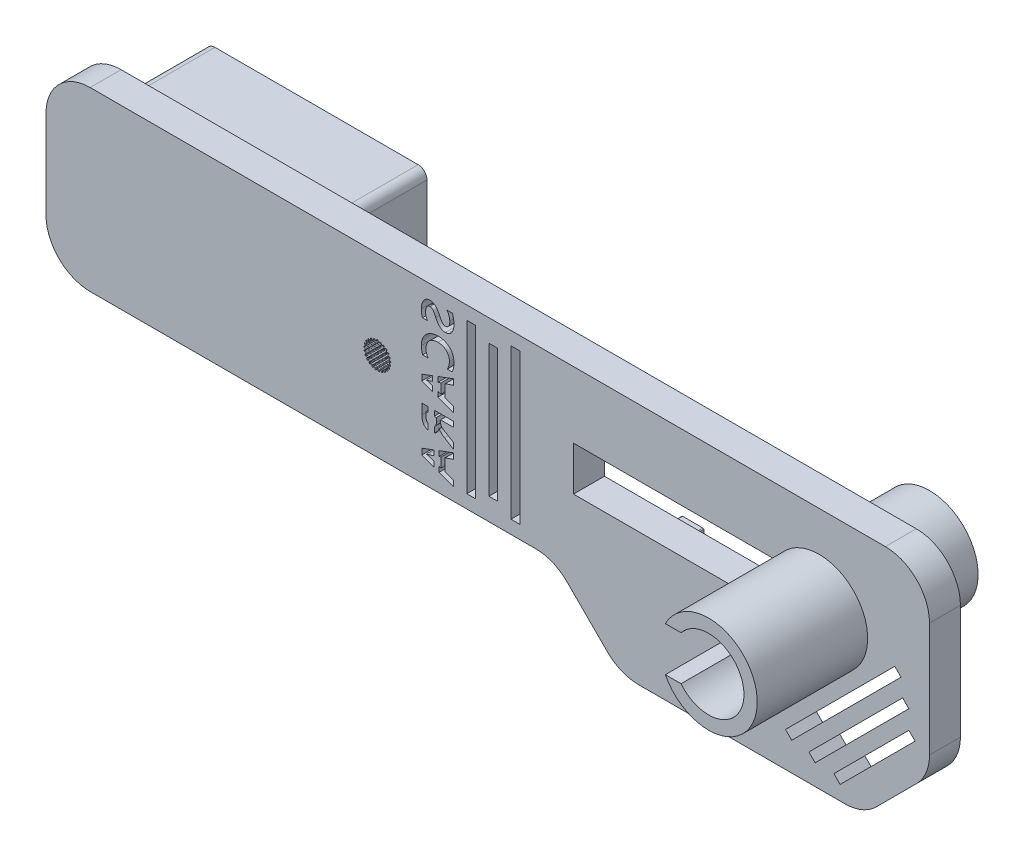
from build123d import *

# Parameters (mm, degrees)
CROQUIS1_W               = 200
CROQUIS1_H               = 40
SALIENTE_EXTRUIR1_DEPTH  = 7
CORTAR_EXTRUIR1_DEPTH    = 10
SALIENTE_EXTRUIR3_DEPTH  = 25
SALIENTE_EXTRUIR5_DEPTH  = 7
CROQUIS9_W               = 5
CROQUIS9_H               = 8
SALIENTE_EXTRUIR6_DEPTH  = 12
CROQUIS10_R              = 1
CORTAR_EXTRUIR2_DEPTH    = 4
CROQUIS11_W              = 50
CROQUIS11_H              = 30
SALIENTE_EXTRUIR7_DEPTH  = 20
CROQUIS12_R              = 1.5
CORTAR_EXTRUIR3_DEPTH    = 10
REDONDEO1_R              = 2
REDONDEO2_R              = 10
REDONDEO3_R              = 0.2
CORTAR_EXTRUIR6_DEPTH    = 7
CROQUIS15_W              = 1.2
CROQUIS15_H              = 5
CROQUIS15_W_2            = 1.4
CROQUIS15_H_2            = 6
SALIENTE_EXTRUIR9_DEPTH  = 7
CROQUIS16_W              = 2
CROQUIS16_H              = 34
CROQUIS16_H_2            = 30
CORTAR_EXTRUIR7_DEPTH    = 7
CORTAR_EXTRUIR8_DEPTH    = 7
CROQUIS19_R              = 3.5
CROQUIS19_R_2            = 1.1
SALIENTE_EXTRUIR10_DEPTH = 3
CROQUIS20_R              = 2.75
CORTAR_EXTRUIR9_DEPTH    = 2.3


with BuildPart() as part:
    # Croquis1 → Saliente-Extruir1 (new body)
    with BuildSketch(Plane.XY):
        with Locations((35.75, 0)):
            Rectangle(CROQUIS1_W, CROQUIS1_H)
        with BuildLine():
            Line((12.626451574, 2.246768253), (12.528569084, 2.182348387))
            ThreePointArc((12.528569084, 2.182348387), (12.34583696, 2.19648114), (12.275928582, 2.365902456))
            Line((12.275928582, 2.365902456), (12.306948162, 2.47890107))
            add(Edge.make_bspline(
                [(12.306948162, 2.47890107), (12.313956369, 2.504430674), (12.318320471, 2.530953923), (12.317315161, 2.571661589), (12.315717027, 2.585623842), (12.30707454, 2.61274149), (12.299647057, 2.627040418), (12.286059536, 2.634961309)],
                knots=[0, 0, 0, 0, 0.5, 0.5, 0.75, 0.75, 1, 1, 1, 1], degree=3))
            ThreePointArc((12.286059536, 2.634961309), (12.219348706, 2.672735374), (12.151709558, 2.708820835))
            add(Edge.make_bspline(
                [(12.151709558, 2.708820835), (12.13775279, 2.71604292), (12.121806118, 2.714681589), (12.094149563, 2.707429812), (12.081587369, 2.701329447), (12.046673806, 2.680382622), (12.026552357, 2.662434562), (12.008750854, 2.642836427)],
                knots=[0, 0, 0, 0, 0.25, 0.25, 0.5, 0.5, 1, 1, 1, 1], degree=3))
            Line((12.008750854, 2.642836427), (11.929964091, 2.556098044))
            ThreePointArc((11.929964091, 2.556098044), (11.749458161, 2.524343159), (11.639612715, 2.671056287))
            Line((11.639612715, 2.671056287), (11.641556145, 2.788219097))
            add(Edge.make_bspline(
                [(11.641556145, 2.788219097), (11.641995222, 2.814689512), (11.639626154, 2.841464792), (11.628528843, 2.880643542), (11.623508646, 2.893769705), (11.608393794, 2.917886104), (11.59764366, 2.929888665), (11.58251317, 2.934181627)],
                knots=[0, 0, 0, 0, 0.5, 0.5, 0.75, 0.75, 1, 1, 1, 1], degree=3))
            ThreePointArc((11.58251317, 2.934181627), (11.508504156, 2.954178641), (11.434015927, 2.972309239))
            add(Edge.make_bspline(
                [(11.434015927, 2.972309239), (11.418701577, 2.975833522), (11.403594448, 2.970549183), (11.378610218, 2.956647329), (11.367959787, 2.947614528), (11.339352362, 2.918643136), (11.324326566, 2.896254945), (11.311958188, 2.872845469)],
                knots=[0, 0, 0, 0, 0.25, 0.25, 0.5, 0.5, 1, 1, 1, 1], degree=3))
            Line((11.311958188, 2.872845469), (11.257217615, 2.769238661))
            ThreePointArc((11.257217615, 2.769238661), (11.090279729, 2.693591414), (10.947399209, 2.808377827))
            Line((10.947399209, 2.808377827), (10.920144377, 2.922343064))
            add(Edge.make_bspline(
                [(10.920144377, 2.922343064), (10.913986734, 2.948091056), (10.905033354, 2.973435979), (10.884541326, 3.008624067), (10.876414505, 3.020089375), (10.855777008, 3.039689202), (10.842379694, 3.048641231), (10.826656941, 3.049036522)],
                knots=[0, 0, 0, 0, 0.5, 0.5, 0.75, 0.75, 1, 1, 1, 1], degree=3))
            ThreePointArc((10.826656941, 3.049036522), (10.75, 3.05), (10.673343059, 3.049036522))
            add(Edge.make_bspline(
                [(10.673343059, 3.049036522), (10.657633385, 3.048641559), (10.644315035, 3.039766248), (10.623572982, 3.020087821), (10.61550352, 3.008690147), (10.594999742, 2.973514567), (10.586013725, 2.948092979), (10.579855623, 2.922343064)],
                knots=[0, 0, 0, 0, 0.25, 0.25, 0.5, 0.5, 1, 1, 1, 1], degree=3))
            Line((10.579855623, 2.922343064), (10.552600791, 2.808377827))
            ThreePointArc((10.552600791, 2.808377827), (10.409720271, 2.693591414), (10.242782385, 2.769238661))
            Line((10.242782385, 2.769238661), (10.188041812, 2.872845469))
            add(Edge.make_bspline(
                [(10.188041812, 2.872845469), (10.175674357, 2.896253197), (10.160699238, 2.918575247), (10.132100083, 2.947561677), (10.121377275, 2.956645723), (10.096513865, 2.970497448), (10.081311173, 2.975836456), (10.065984073, 2.972309239)],
                knots=[0, 0, 0, 0, 0.5, 0.5, 0.75, 0.75, 1, 1, 1, 1], degree=3))
            ThreePointArc((10.065984073, 2.972309239), (9.991495844, 2.954178641), (9.91748683, 2.934181627))
            add(Edge.make_bspline(
                [(9.91748683, 2.934181627), (9.902368927, 2.929892236), (9.891676198, 2.917983619), (9.876479619, 2.893765087), (9.871498161, 2.880718699), (9.860386358, 2.841549142), (9.858004745, 2.814691489), (9.858443855, 2.788219097)],
                knots=[0, 0, 0, 0, 0.25, 0.25, 0.5, 0.5, 1, 1, 1, 1], degree=3))
            Line((9.858443855, 2.788219097), (9.860387285, 2.671056287))
            ThreePointArc((9.860387285, 2.671056287), (9.750541839, 2.524343159), (9.570035909, 2.556098044))
            Line((9.570035909, 2.556098044), (9.491249146, 2.642836427))
            add(Edge.make_bspline(
                [(9.491249146, 2.642836427), (9.473448973, 2.662433098), (9.453393056, 2.680329699), (9.418483765, 2.701293146), (9.405838722, 2.707425146), (9.378311658, 2.714658415), (9.362258829, 2.716048933), (9.348290442, 2.708820835)],
                knots=[0, 0, 0, 0, 0.5, 0.5, 0.75, 0.75, 1, 1, 1, 1], degree=3))
            ThreePointArc((9.348290442, 2.708820835), (9.280651294, 2.672735374), (9.213940464, 2.634961309))
            add(Edge.make_bspline(
                [(9.213940464, 2.634961309), (9.200364246, 2.627047007), (9.192969001, 2.612853348), (9.184272755, 2.585616451), (9.182692303, 2.571741101), (9.181670671, 2.531038735), (9.186043108, 2.504432581), (9.193051838, 2.47890107)],
                knots=[0, 0, 0, 0, 0.25, 0.25, 0.5, 0.5, 1, 1, 1, 1], degree=3))
            Line((9.193051838, 2.47890107), (9.224071418, 2.365902456))
            ThreePointArc((9.224071418, 2.365902456), (9.15416304, 2.19648114), (8.971430916, 2.182348387))
            Line((8.971430916, 2.182348387), (8.873548426, 2.246768253))
            add(Edge.make_bspline(
                [(8.873548426, 2.246768253), (8.851433984, 2.261322535), (8.827557457, 2.273669178), (8.788531508, 2.285292432), (8.774758767, 2.28808709), (8.746297675, 2.28824741), (8.730403367, 2.285602066), (8.718671378, 2.275127255)],
                knots=[0, 0, 0, 0, 0.5, 0.5, 0.75, 0.75, 1, 1, 1, 1], degree=3))
            ThreePointArc((8.718671378, 2.275127255), (8.662131327, 2.223354314), (8.606910368, 2.170176682))
            add(Edge.make_bspline(
                [(8.606910368, 2.170176682), (8.595728879, 2.159134754), (8.592095789, 2.143547892), (8.590446293, 2.115004024), (8.592366153, 2.101171551), (8.601498883, 2.061493855), (8.612350633, 2.036810963), (8.6254886, 2.013824572)],
                knots=[0, 0, 0, 0, 0.25, 0.25, 0.5, 0.5, 1, 1, 1, 1], degree=3))
            Line((8.6254886, 2.013824572), (8.683635255, 1.912090273))
            ThreePointArc((8.683635255, 1.912090273), (8.658056546, 1.730606132), (8.484579961, 1.671473755))
            Line((8.484579961, 1.671473755), (8.373752059, 1.709527367))
            add(Edge.make_bspline(
                [(8.373752059, 1.709527367), (8.34871288, 1.718124761), (8.322515994, 1.72414566), (8.28182553, 1.72569839), (8.267790482, 1.724980107), (8.240183677, 1.718057405), (8.22544659, 1.711542415), (8.216688161, 1.698479063)],
                knots=[0, 0, 0, 0, 0.5, 0.5, 0.75, 0.75, 1, 1, 1, 1], degree=3))
            ThreePointArc((8.216688161, 1.698479063), (8.174799827, 1.634271725), (8.134538476, 1.569031872))
            add(Edge.make_bspline(
                [(8.134538476, 1.569031872), (8.126454289, 1.555556123), (8.126811634, 1.539555439), (8.132312531, 1.511498115), (8.137612072, 1.498577664), (8.156325323, 1.462417734), (8.172974531, 1.441209022), (8.191416227, 1.422212069)],
                knots=[0, 0, 0, 0, 0.25, 0.25, 0.5, 0.5, 1, 1, 1, 1], degree=3))
            Line((8.191416227, 1.422212069), (8.273036389, 1.338134426))
            ThreePointArc((8.273036389, 1.338134426), (8.293394553, 1.155990777), (8.140073677, 1.055574279))
            Line((8.140073677, 1.055574279), (8.02326409, 1.064870589))
            add(Edge.make_bspline(
                [(8.02326409, 1.064870589), (7.996873478, 1.06697089), (7.970002278, 1.06628773), (7.930204032, 1.057672371), (7.91678855, 1.05348628), (7.89177067, 1.039915534), (7.879116787, 1.02994026), (7.873882245, 1.015109185)],
                knots=[0, 0, 0, 0, 0.5, 0.5, 0.75, 0.75, 1, 1, 1, 1], degree=3))
            ThreePointArc((7.873882245, 1.015109185), (7.849277625, 0.942501833), (7.82650565, 0.869299019))
            add(Edge.make_bspline(
                [(7.82650565, 0.869299019), (7.822026725, 0.85423618), (7.826352052, 0.838827055), (7.838657701, 0.813019221), (7.847003932, 0.801822632), (7.874121881, 0.771452529), (7.895522416, 0.755050617), (7.918109082, 0.741236752)],
                knots=[0, 0, 0, 0, 0.25, 0.25, 0.5, 0.5, 1, 1, 1, 1], degree=3))
            Line((7.918109082, 0.741236752), (8.018074257, 0.680098671))
            ThreePointArc((8.018074257, 0.680098671), (8.083090114, 0.508740269), (7.959558664, 0.37334919))
            Line((7.959558664, 0.37334919), (7.844106966, 0.353304075))
            add(Edge.make_bspline(
                [(7.844106966, 0.353304075), (7.81802314, 0.348775313), (7.792166043, 0.341431021), (7.755760685, 0.323188908), (7.743807714, 0.315798035), (7.722950724, 0.296431946), (7.713175135, 0.283623171), (7.711793384, 0.267956263)],
                knots=[0, 0, 0, 0, 0.5, 0.5, 0.75, 0.75, 1, 1, 1, 1], degree=3))
            ThreePointArc((7.711793384, 0.267956263), (7.706018478, 0.191511085), (7.702166726, 0.114944912))
            add(Edge.make_bspline(
                [(7.702166726, 0.114944912), (7.70157449, 0.099241437), (7.709596023, 0.085392082), (7.727933215, 0.06345534), (7.738801712, 0.054686135), (7.772620438, 0.032014124), (7.797427625, 0.021449605), (7.822740058, 0.013686803)],
                knots=[0, 0, 0, 0, 0.25, 0.25, 0.5, 0.5, 1, 1, 1, 1], degree=3))
            Line((7.822740058, 0.013686803), (7.934769066, -0.020670184))
            ThreePointArc((7.934769066, -0.020670184), (8.040357432, -0.170476261), (7.954377342, -0.332334803))
            Line((7.954377342, -0.332334803), (7.847537789, -0.380461833))
            add(Edge.make_bspline(
                [(7.847537789, -0.380461833), (7.823399691, -0.391335099), (7.800181394, -0.404879056), (7.769456406, -0.431601703), (7.759716995, -0.441732961), (7.744331416, -0.465677552), (7.738048359, -0.480515006), (7.740606219, -0.496033336)],
                knots=[0, 0, 0, 0, 0.5, 0.5, 0.75, 0.75, 1, 1, 1, 1], degree=3))
            ThreePointArc((7.740606219, -0.496033336), (7.754023885, -0.571513009), (7.769334376, -0.646631607))
            add(Edge.make_bspline(
                [(7.769334376, -0.646631607), (7.772666042, -0.661989012), (7.783879757, -0.673408389), (7.807096299, -0.690095674), (7.819804154, -0.695886493), (7.858198703, -0.709435846), (7.884853816, -0.713499165), (7.911301543, -0.714723137)],
                knots=[0, 0, 0, 0, 0.25, 0.25, 0.5, 0.5, 1, 1, 1, 1], degree=3))
            Line((7.911301543, -0.714723137), (8.028355188, -0.720140256))
            ThreePointArc((8.028355188, -0.720140256), (8.167881558, -0.83898114), (8.124855273, -1.017136977))
            Line((8.124855273, -1.017136977), (8.033340986, -1.090321925))
            add(Edge.make_bspline(
                [(8.033340986, -1.090321925), (8.012665303, -1.106856488), (7.993544696, -1.125749092), (7.970430643, -1.159273192), (7.963516754, -1.171508251), (7.954569319, -1.198526816), (7.95217358, -1.214460657), (7.958510333, -1.228855337)],
                knots=[0, 0, 0, 0, 0.5, 0.5, 0.75, 0.75, 1, 1, 1, 1], degree=3))
            ThreePointArc((7.958510333, -1.228855337), (7.99027749, -1.298626839), (8.023788209, -1.367577884))
            add(Edge.make_bspline(
                [(8.023788209, -1.367577884), (8.030834436, -1.381624256), (8.044535735, -1.389896134), (8.071172845, -1.400285439), (8.084921579, -1.402734013), (8.125479479, -1.406309352), (8.152307679, -1.403616158), (8.178228891, -1.398224395)],
                knots=[0, 0, 0, 0, 0.25, 0.25, 0.5, 0.5, 1, 1, 1, 1], degree=3))
            Line((8.178228891, -1.398224395), (8.292952264, -1.374361266))
            ThreePointArc((8.292952264, -1.374361266), (8.457649682, -1.454769748), (8.460280702, -1.638028695))
            Line((8.460280702, -1.638028695), (8.389841861, -1.73167308))
            add(Edge.make_bspline(
                [(8.389841861, -1.73167308), (8.373927722, -1.752830013), (8.360106223, -1.775884173), (8.346055445, -1.814103283), (8.342401504, -1.827673369), (8.340454413, -1.856068233), (8.342096526, -1.872097279), (8.351814009, -1.884463837)],
                knots=[0, 0, 0, 0, 0.5, 0.5, 0.75, 0.75, 1, 1, 1, 1], degree=3))
            ThreePointArc((8.351814009, -1.884463837), (8.39993461, -1.944143169), (8.449539955, -2.002594213))
            add(Edge.make_bspline(
                [(8.449539955, -2.002594213), (8.459858002, -2.014446966), (8.475185983, -2.019051594), (8.503569954, -2.02249012), (8.517495681, -2.021442596), (8.557668531, -2.01481927), (8.582984104, -2.005538785), (8.606750077, -1.993870071)],
                knots=[0, 0, 0, 0, 0.25, 0.25, 0.5, 0.5, 1, 1, 1, 1], degree=3))
            Line((8.606750077, -1.993870071), (8.711934685, -1.942226104))
            ThreePointArc((8.711934685, -1.942226104), (8.891454607, -1.979149823), (8.939577615, -2.155997045))
            Line((8.939577615, -2.155997045), (8.894640152, -2.264216847))
            add(Edge.make_bspline(
                [(8.894640152, -2.264216847), (8.8844875, -2.288666782), (8.876833565, -2.314433919), (8.872728924, -2.354946593), (8.872564522, -2.368999047), (8.877740118, -2.396986056), (8.883316902, -2.412103143), (8.895804531, -2.421664544)],
                knots=[0, 0, 0, 0, 0.5, 0.5, 0.75, 0.75, 1, 1, 1, 1], degree=3))
            ThreePointArc((8.895804531, -2.421664544), (8.957254981, -2.467501833), (9.019838066, -2.511780182))
            add(Edge.make_bspline(
                [(9.019838066, -2.511780182), (9.032779613, -2.520694566), (9.048771162, -2.521342617), (9.077118525, -2.517614308), (9.090346241, -2.513136507), (9.127609833, -2.496730684), (9.149822107, -2.481446035), (9.169939537, -2.464233558)],
                knots=[0, 0, 0, 0, 0.25, 0.25, 0.5, 0.5, 1, 1, 1, 1], degree=3))
            Line((9.169939537, -2.464233558), (9.258976245, -2.388053733))
            ThreePointArc((9.258976245, -2.388053733), (9.442038775, -2.379172636), (9.532630026, -2.538496172))
            Line((9.532630026, -2.538496172), (9.516017526, -2.654491542))
            add(Edge.make_bspline(
                [(9.516017526, -2.654491542), (9.512264289, -2.680698199), (9.511258844, -2.707559271), (9.51735825, -2.747819947), (9.520693716, -2.761471803), (9.532666797, -2.78729243), (9.541827843, -2.800547697), (9.556300973, -2.806703161)],
                knots=[0, 0, 0, 0, 0.5, 0.5, 0.75, 0.75, 1, 1, 1, 1], degree=3))
            ThreePointArc((9.556300973, -2.806703161), (9.627220114, -2.835818282), (9.698848615, -2.863141765))
            add(Edge.make_bspline(
                [(9.698848615, -2.863141765), (9.713600496, -2.868557655), (9.729250805, -2.86520841), (9.755780391, -2.854547531), (9.76747895, -2.846920809), (9.799491875, -2.821763326), (9.817205173, -2.801434904), (9.832410008, -2.779760188)],
                knots=[0, 0, 0, 0, 0.25, 0.25, 0.5, 0.5, 1, 1, 1, 1], degree=3))
            Line((9.832410008, -2.779760188), (9.899704311, -2.683831163))
            ThreePointArc((9.899704311, -2.683831163), (10.074806956, -2.629703282), (10.202174268, -2.761492248))
            Line((10.202174268, -2.761492248), (10.214930556, -2.877974772))
            add(Edge.make_bspline(
                [(10.214930556, -2.877974772), (10.217812565, -2.90429149), (10.223518785, -2.930558716), (10.239438989, -2.968037668), (10.246064745, -2.98043113), (10.264082998, -3.00246297), (10.276252684, -3.013023538), (10.291801916, -3.015386296)],
                knots=[0, 0, 0, 0, 0.5, 0.5, 0.75, 0.75, 1, 1, 1, 1], degree=3))
            ThreePointArc((10.291801916, -3.015386296), (10.367733638, -3.025949839), (10.443906871, -3.034601621))
            add(Edge.make_bspline(
                [(10.443906871, -3.034601621), (10.459542172, -3.036178717), (10.473867874, -3.029042621), (10.496912731, -3.012119033), (10.50634707, -3.001822605), (10.531097839, -2.9694942), (10.543199168, -2.945399316), (10.552536032, -2.920624261)],
                knots=[0, 0, 0, 0, 0.25, 0.25, 0.5, 0.5, 1, 1, 1, 1], degree=3))
            Line((10.552536032, -2.920624261), (10.593859583, -2.810973611))
            ThreePointArc((10.593859583, -2.810973611), (10.75, -2.715), (10.906140417, -2.810973611))
            Line((10.906140417, -2.810973611), (10.947463968, -2.920624261))
            add(Edge.make_bspline(
                [(10.947463968, -2.920624261), (10.956800135, -2.945397466), (10.968859477, -2.969420379), (10.993600155, -3.001762667), (11.003099879, -3.012119007), (11.026031152, -3.028977719), (11.040444811, -3.03618003), (11.056093129, -3.034601621)],
                knots=[0, 0, 0, 0, 0.5, 0.5, 0.75, 0.75, 1, 1, 1, 1], degree=3))
            ThreePointArc((11.056093129, -3.034601621), (11.132266362, -3.025949839), (11.208198084, -3.015386296))
            add(Edge.make_bspline(
                [(11.208198084, -3.015386296), (11.223734381, -3.013025504), (11.23583534, -3.002550944), (11.253947476, -2.980428019), (11.2605248, -2.968108848), (11.27645823, -2.930640833), (11.28218722, -2.904293456), (11.285069444, -2.877974772)],
                knots=[0, 0, 0, 0, 0.25, 0.25, 0.5, 0.5, 1, 1, 1, 1], degree=3))
            Line((11.285069444, -2.877974772), (11.297825732, -2.761492248))
            ThreePointArc((11.297825732, -2.761492248), (11.425193044, -2.629703282), (11.600295689, -2.683831163))
            Line((11.600295689, -2.683831163), (11.667589992, -2.779760188))
            add(Edge.make_bspline(
                [(11.667589992, -2.779760188), (11.682793692, -2.801433286), (11.700448423, -2.821702439), (11.732455027, -2.846875878), (11.744231816, -2.854544369), (11.770635253, -2.865170658), (11.786387222, -2.868562164), (11.801151385, -2.863141765)],
                knots=[0, 0, 0, 0, 0.5, 0.5, 0.75, 0.75, 1, 1, 1, 1], degree=3))
            ThreePointArc((11.801151385, -2.863141765), (11.872779886, -2.835818282), (11.943699027, -2.806703161))
            add(Edge.make_bspline(
                [(11.943699027, -2.806703161), (11.958160117, -2.800552817), (11.967275985, -2.787397949), (11.979317347, -2.761465751), (11.982624379, -2.747897895), (11.988739315, -2.707644524), (11.987735991, -2.680700157), (11.983982474, -2.654491542)],
                knots=[0, 0, 0, 0, 0.25, 0.25, 0.5, 0.5, 1, 1, 1, 1], degree=3))
            Line((11.983982474, -2.654491542), (11.967369974, -2.538496172))
            ThreePointArc((11.967369974, -2.538496172), (12.057961225, -2.379172636), (12.241023755, -2.388053733))
            Line((12.241023755, -2.388053733), (12.330060463, -2.464233558))
            add(Edge.make_bspline(
                [(12.330060463, -2.464233558), (12.35017639, -2.48144475), (12.372317199, -2.496686557), (12.409578637, -2.513109407), (12.422892513, -2.51760821), (12.451109087, -2.521334387), (12.467209612, -2.520701987), (12.480161934, -2.511780182)],
                knots=[0, 0, 0, 0, 0.5, 0.5, 0.75, 0.75, 1, 1, 1, 1], degree=3))
            ThreePointArc((12.480161934, -2.511780182), (12.542745019, -2.467501833), (12.604195469, -2.421664544))
            add(Edge.make_bspline(
                [(12.604195469, -2.421664544), (12.61667271, -2.412111097), (12.622230703, -2.39710249), (12.627444688, -2.368990435), (12.627273635, -2.355026412), (12.623185853, -2.314516952), (12.615513259, -2.288668608), (12.605359848, -2.264216847)],
                knots=[0, 0, 0, 0, 0.25, 0.25, 0.5, 0.5, 1, 1, 1, 1], degree=3))
            Line((12.605359848, -2.264216847), (12.560422385, -2.155997045))
            ThreePointArc((12.560422385, -2.155997045), (12.608545393, -1.979149823), (12.788065315, -1.942226104))
            Line((12.788065315, -1.942226104), (12.893249923, -1.993870071))
            add(Edge.make_bspline(
                [(12.893249923, -1.993870071), (12.917014121, -2.005537914), (12.942249819, -2.014794677), (12.982424817, -2.02143503), (12.99643922, -2.022481469), (13.024695981, -2.019073404), (13.040133407, -2.014456834), (13.050460045, -2.002594213)],
                knots=[0, 0, 0, 0, 0.5, 0.5, 0.75, 0.75, 1, 1, 1, 1], degree=3))
            ThreePointArc((13.050460045, -2.002594213), (13.10006539, -1.944143169), (13.148185991, -1.884463837))
            add(Edge.make_bspline(
                [(13.148185991, -1.884463837), (13.15789539, -1.872107566), (13.15954628, -1.856188265), (13.157605275, -1.827662736), (13.153966885, -1.814179958), (13.139933234, -1.775959767), (13.126073467, -1.752831593), (13.110158139, -1.73167308)],
                knots=[0, 0, 0, 0, 0.25, 0.25, 0.5, 0.5, 1, 1, 1, 1], degree=3))
            Line((13.110158139, -1.73167308), (13.039719298, -1.638028695))
            ThreePointArc((13.039719298, -1.638028695), (13.042350318, -1.454769748), (13.207047736, -1.374361266))
            Line((13.207047736, -1.374361266), (13.321771109, -1.398224395))
            add(Edge.make_bspline(
                [(13.321771109, -1.398224395), (13.347690385, -1.403615755), (13.374435321, -1.406305837), (13.414999536, -1.402746455), (13.428833889, -1.400274778), (13.455355361, -1.389946614), (13.469159698, -1.38163595), (13.476211791, -1.367577884)],
                knots=[0, 0, 0, 0, 0.5, 0.5, 0.75, 0.75, 1, 1, 1, 1], degree=3))
            ThreePointArc((13.476211791, -1.367577884), (13.50972251, -1.298626839), (13.541489667, -1.228855337))
            add(Edge.make_bspline(
                [(13.541489667, -1.228855337), (13.547821148, -1.214472631), (13.545461203, -1.198642904), (13.536487167, -1.171496266), (13.529610054, -1.159341906), (13.506512321, -1.125812499), (13.487336241, -1.106857723), (13.466659014, -1.090321925)],
                knots=[0, 0, 0, 0, 0.25, 0.25, 0.5, 0.5, 1, 1, 1, 1], degree=3))
            Line((13.466659014, -1.090321925), (13.375144727, -1.017136977))
            ThreePointArc((13.375144727, -1.017136977), (13.332118442, -0.83898114), (13.471644812, -0.720140256))
            Line((13.471644812, -0.720140256), (13.588698457, -0.714723137))
            add(Edge.make_bspline(
                [(13.588698457, -0.714723137), (13.615144209, -0.713499256), (13.641717899, -0.709453629), (13.680122533, -0.695918162), (13.692907573, -0.690083673), (13.716027314, -0.673484365), (13.727331184, -0.662001797), (13.730665624, -0.646631607)],
                knots=[0, 0, 0, 0, 0.5, 0.5, 0.75, 0.75, 1, 1, 1, 1], degree=3))
            ThreePointArc((13.730665624, -0.646631607), (13.745976115, -0.571513009), (13.759393781, -0.496033336))
            add(Edge.make_bspline(
                [(13.759393781, -0.496033336), (13.761949514, -0.480527915), (13.755727018, -0.465782402), (13.740283823, -0.441720378), (13.7306001, -0.431658137), (13.699889601, -0.404926291), (13.676602111, -0.391335911), (13.652462211, -0.380461833)],
                knots=[0, 0, 0, 0, 0.25, 0.25, 0.5, 0.5, 1, 1, 1, 1], degree=3))
            Line((13.652462211, -0.380461833), (13.545622658, -0.332334803))
            ThreePointArc((13.545622658, -0.332334803), (13.459642568, -0.170476261), (13.565230934, -0.020670184))
            Line((13.565230934, -0.020670184), (13.677259942, 0.013686803))
            add(Edge.make_bspline(
                [(13.677259942, 0.013686803), (13.702570484, 0.021449025), (13.727303207, 0.031976159), (13.761135154, 0.054637229), (13.772067551, 0.063467926), (13.790332863, 0.085295383), (13.798426003, 0.099228363), (13.797833274, 0.114944912)],
                knots=[0, 0, 0, 0, 0.5, 0.5, 0.75, 0.75, 1, 1, 1, 1], degree=3))
            ThreePointArc((13.797833274, 0.114944912), (13.793981522, 0.191511085), (13.788206616, 0.267956263))
            add(Edge.make_bspline(
                [(13.788206616, 0.267956263), (13.786826014, 0.283610138), (13.777131949, 0.296344921), (13.756189949, 0.315810427), (13.74430808, 0.3231483), (13.707914469, 0.341402925), (13.681978808, 0.348774975), (13.655893034, 0.353304075)],
                knots=[0, 0, 0, 0, 0.25, 0.25, 0.5, 0.5, 1, 1, 1, 1], degree=3))
            Line((13.655893034, 0.353304075), (13.540441336, 0.37334919))
            ThreePointArc((13.540441336, 0.37334919), (13.416909886, 0.508740269), (13.481925743, 0.680098671))
            Line((13.481925743, 0.680098671), (13.581890918, 0.741236752))
            add(Edge.make_bspline(
                [(13.581890918, 0.741236752), (13.604475898, 0.755049585), (13.625813604, 0.771396768), (13.65294708, 0.801759561), (13.66133991, 0.813031603), (13.673603116, 0.838715708), (13.677977004, 0.85422364), (13.67349435, 0.869299019)],
                knots=[0, 0, 0, 0, 0.5, 0.5, 0.75, 0.75, 1, 1, 1, 1], degree=3))
            ThreePointArc((13.67349435, 0.869299019), (13.650722375, 0.942501833), (13.626117755, 1.015109185))
            add(Edge.make_bspline(
                [(13.626117755, 1.015109185), (13.620887567, 1.029927923), (13.608331048, 1.039851804), (13.583206104, 1.053497701), (13.569872672, 1.05765014), (13.530082691, 1.06628054), (13.503128493, 1.066971047), (13.47673591, 1.064870589)],
                knots=[0, 0, 0, 0, 0.25, 0.25, 0.5, 0.5, 1, 1, 1, 1], degree=3))
            Line((13.47673591, 1.064870589), (13.359926323, 1.055574279))
            ThreePointArc((13.359926323, 1.055574279), (13.206605447, 1.155990777), (13.226963611, 1.338134426))
            Line((13.226963611, 1.338134426), (13.308583773, 1.422212069))
            add(Edge.make_bspline(
                [(13.308583773, 1.422212069), (13.327024092, 1.441207603), (13.343626056, 1.462347681), (13.362356165, 1.498504392), (13.367682076, 1.511509514), (13.373172633, 1.539436441), (13.373552441, 1.555544904), (13.365461524, 1.569031872)],
                knots=[0, 0, 0, 0, 0.5, 0.5, 0.75, 0.75, 1, 1, 1, 1], degree=3))
            ThreePointArc((13.365461524, 1.569031872), (13.325200173, 1.634271725), (13.283311839, 1.698479063))
            add(Edge.make_bspline(
                [(13.283311839, 1.698479063), (13.274560696, 1.711531548), (13.259930694, 1.718020973), (13.2322015, 1.72498984), (13.218254292, 1.725695933), (13.177568094, 1.724159827), (13.15128899, 1.718125403), (13.126247941, 1.709527367)],
                knots=[0, 0, 0, 0, 0.25, 0.25, 0.5, 0.5, 1, 1, 1, 1], degree=3))
            Line((13.126247941, 1.709527367), (13.015420039, 1.671473755))
            ThreePointArc((13.015420039, 1.671473755), (12.841943454, 1.730606132), (12.816364745, 1.912090273))
            Line((12.816364745, 1.912090273), (12.8745114, 2.013824572))
            add(Edge.make_bspline(
                [(12.8745114, 2.013824572), (12.887648385, 2.036809246), (12.898471445, 2.06141391), (12.907621304, 2.101092681), (12.909545649, 2.115013723), (12.907918567, 2.14342872), (12.90428043, 2.159125561), (12.893089632, 2.170176682)],
                knots=[0, 0, 0, 0, 0.5, 0.5, 0.75, 0.75, 1, 1, 1, 1], degree=3))
            ThreePointArc((12.893089632, 2.170176682), (12.837868673, 2.223354314), (12.781328622, 2.275127255))
            add(Edge.make_bspline(
                [(12.781328622, 2.275127255), (12.769606392, 2.285593352), (12.753822164, 2.288240566), (12.725231047, 2.288094523), (12.711546418, 2.285309903), (12.672520466, 2.273703811), (12.648567668, 2.261323622), (12.626451574, 2.246768253)],
                knots=[0, 0, 0, 0, 0.25, 0.25, 0.5, 0.5, 1, 1, 1, 1], degree=3))
        make_face(mode=Mode.SUBTRACT)
    extrude(amount=SALIENTE_EXTRUIR1_DEPTH)

    # Croquis2 → Cortar-Extruir1 (cut)
    with BuildSketch(Plane.XY.offset(7)):
        with BuildLine():
            Line((55.16, 5), (104.505002002, 5))
            ThreePointArc((104.505002002, 5), (118.75, 0), (104.505002002, -5))
            Line((104.505002002, -5), (55.16, -5))
            Line((55.16, -5), (55.16, 5))
        make_face()
    extrude(amount=-CORTAR_EXTRUIR1_DEPTH, mode=Mode.SUBTRACT)

    # Croquis5 → Saliente-Extruir3 (add, symmetric)
    with BuildSketch(Plane.XY.offset(7)):
        with BuildLine():
            Line((104.505002002, 5), (100.952041029, 5))
            ThreePointArc((100.952041029, 5), (121.75, 0), (100.952041029, -5))
            Line((100.952041029, -5), (104.505002002, -5))
            ThreePointArc((104.505002002, -5), (118.75, 0), (104.505002002, 5))
        make_face()
    extrude(amount=SALIENTE_EXTRUIR3_DEPTH, both=True)

    # Croquis8 → Saliente-Extruir5 (add)
    with BuildSketch(Plane(origin=(0, 0, 0), x_dir=(-1, 0, 0), z_dir=(0, 0, -1))):
        Polygon((-135.75, -20), (-120.75, -35), (-65.75, -35), (-50.75, -20), align=None)
    extrude(amount=-SALIENTE_EXTRUIR5_DEPTH)

    # Croquis9 → Saliente-Extruir6 (add)
    with BuildSketch(Plane(origin=(0, 0, 0), x_dir=(-1, 0, 0), z_dir=(0, 0, -1))):
        with Locations((-63.16, -20)):
            Rectangle(CROQUIS9_W, CROQUIS9_H)
        with Locations((-91.16, -20)):
            Rectangle(CROQUIS9_W, CROQUIS9_H)
    extrude(amount=SALIENTE_EXTRUIR6_DEPTH)

    # Croquis10 → Cortar-Extruir2 (cut)
    with BuildSketch(Plane(origin=(0, -16, 0), x_dir=(1, 0, 0), z_dir=(0, 1, 0))):
        with Locations((63.26, 6.3)):
            Circle(CROQUIS10_R)
        with Locations((91.06, 6.3)):
            Circle(CROQUIS10_R)
    extrude(amount=-CORTAR_EXTRUIR2_DEPTH, mode=Mode.SUBTRACT)

    # Croquis11 → Saliente-Extruir7 (add)
    with BuildSketch(Plane(origin=(0, 0, 0), x_dir=(-1, 0, 0), z_dir=(0, 0, -1))):
        with Locations((30, 0)):
            Rectangle(CROQUIS11_W, CROQUIS11_H)
        Polygon((8, 9), (11, 9), (11, 12), (52, 12), (52, -9), (49, -9), (49, -12), (8, -12), align=None, mode=Mode.SUBTRACT)
    extrude(amount=SALIENTE_EXTRUIR7_DEPTH)

    # Croquis12 → Cortar-Extruir3 (cut)
    with BuildSketch(Plane(origin=(0, 0, -20), x_dir=(-1, 0, 0), z_dir=(0, 0, -1))):
        with Locations((8, 12)):
            Circle(CROQUIS12_R)
        with Locations((52, -12)):
            Circle(CROQUIS12_R)
    extrude(amount=-CORTAR_EXTRUIR3_DEPTH, mode=Mode.SUBTRACT)

    # Redondeo1
    redondeo1_edges = [part.edges().sort_by_distance(p)[0] for p in [
        (-49, -9, -10),
        (-11, 9, -10),
        (-5, 15, -10),
        (-55, 15, -10),
        (-55, -15, -10),
        (-5, -15, -10),
    ]]
    fillet(redondeo1_edges, radius=REDONDEO1_R)

    # Redondeo2
    redondeo2_edges = [part.edges().sort_by_distance(p)[0] for p in [
        (-64.25, 20, 3.5),
        (-64.25, -20, 3.5),
        (50.75, -20, 3.5),
        (65.75, -35, 3.5),
        (120.75, -35, 3.5),
        (135.75, -20, 3.5),
        (135.75, 20, 3.5),
    ]]
    fillet(redondeo2_edges, radius=REDONDEO2_R)

    # Redondeo3
    redondeo3_edges = [part.edges().sort_by_distance(p)[0] for p in [
        (88.66, -16, -6),
        (93.66, -16, -6),
        (93.66, -24, -6),
        (88.66, -24, -6),
        (60.66, -24, -6),
        (65.66, -24, -6),
        (65.66, -16, -6),
        (60.66, -16, -6),
    ]]
    fillet(redondeo3_edges, radius=REDONDEO3_R)

    # Croquis13 → Cortar-Extruir6 (cut)
    # profile 1 of 5: a face of its own
    with BuildSketch(Plane(origin=(0, 0, 0), x_dir=(-1, 0, 0), z_dir=(0, 0, -1))):
        with BuildLine():
            Line((-27.705434577, 16.751985348), (-26.496043723, 16.751985348))
            add(Edge.make_bspline(
                [(-26.496043723, 16.751985348), (-26.546456147, 16.693077017), (-26.650912971, 16.57101629), (-26.779467165, 16.359116289), (-26.890161465, 16.126353245), (-26.984389915, 15.88054374), (-27.059096684, 15.627223255), (-27.114538695, 15.375313773), (-27.15032256, 15.133073161), (-27.155789474, 14.975952722), (-27.158399594, 14.900937244)],
                knots=[0, 0, 0, 0, 0.927578273, 1.92198412, 2.957092759, 4.012954806, 5.072112824, 6.117824666, 7.101375461, 8, 8, 8, 8], degree=3))
            add(Edge.make_bspline(
                [(-27.158399594, 14.900937244), (-27.15751041, 14.840787059), (-27.15578129, 14.723818078), (-27.143580371, 14.55463324), (-27.126006984, 14.39668788), (-27.094739497, 14.25160497), (-27.061242394, 14.116864907), (-27.016045665, 13.995016519), (-26.964902485, 13.884397942), (-26.903843989, 13.78648917), (-26.835760964, 13.699788001), (-26.759346029, 13.625256896), (-26.67641293, 13.560979671), (-26.585327692, 13.508877082), (-26.48730169, 13.468902797), (-26.381946514, 13.440951526), (-26.269979531, 13.422670896), (-26.19253768, 13.420575924), (-26.153038003, 13.419507371)],
                knots=[0, 0, 0, 0, 1.422778642, 2.766757364, 4.011827703, 5.177920422, 6.275129936, 7.293106281, 8.247474681, 9.153325811, 10.016376933, 10.849048824, 11.672198523, 12.492121956, 13.323486925, 14.169116947, 15.066147211, 16, 16, 16, 16], degree=3))
            add(Edge.make_bspline(
                [(-26.153038003, 13.419507371), (-26.111996898, 13.420697052), (-26.031655208, 13.423025961), (-25.916458748, 13.447858846), (-25.80877771, 13.484465896), (-25.710077921, 13.539042663), (-25.618990456, 13.608229842), (-25.530470505, 13.687397179), (-25.446427734, 13.778732044), (-25.339520364, 13.922675433), (-25.211431984, 14.1285771), (-25.069471631, 14.406795597), (-24.927333813, 14.713901839), (-24.828840408, 14.926080869), (-24.778058181, 15.03547828)],
                knots=[0, 0, 0, 0, 0.656509089, 1.285176119, 1.879487901, 2.473064994, 3.082600747, 3.708783899, 4.37373703, 5.066963406, 6.578439194, 8.252345871, 10.067746561, 12, 12, 12, 12], degree=3))
            add(Edge.make_bspline(
                [(-24.778058181, 15.03547828), (-24.713900316, 15.153277228), (-24.588814991, 15.382943843), (-24.421913637, 15.659142957), (-24.285470657, 15.866248192), (-24.177109094, 16.007897288), (-24.064672477, 16.140209494), (-23.946578075, 16.262325522), (-23.820434539, 16.371381432), (-23.688654707, 16.470666885), (-23.547161315, 16.554216356), (-23.398798141, 16.628313725), (-23.238149435, 16.686221793), (-23.065987282, 16.729460156), (-22.879817212, 16.752368771), (-22.752114111, 16.756013067), (-22.686018989, 16.75789924)],
                knots=[0, 0, 0, 0, 1.957929992, 3.817276486, 4.709181866, 5.576820163, 6.418786209, 7.242952715, 8.053728572, 8.850856414, 9.647886856, 10.449030154, 11.268346913, 12.135537704, 13.035012759, 14, 14, 14, 14], degree=3))
            add(Edge.make_bspline(
                [(-22.686018989, 16.75789924), (-22.605046172, 16.754869099), (-22.446934606, 16.748952295), (-22.217306064, 16.708388072), (-22.005329126, 16.634481467), (-21.810165132, 16.534801419), (-21.632991454, 16.410855838), (-21.470714121, 16.269768591), (-21.324371478, 16.110416274), (-21.196694684, 15.931960952), (-21.082983657, 15.739980112), (-20.98441083, 15.534383509), (-20.90400123, 15.315156501), (-20.838130927, 15.085234746), (-20.786147631, 14.848236144), (-20.751792104, 14.606497461), (-20.728217054, 14.362745415), (-20.72546372, 14.199211082), (-20.724085415, 14.117346592)],
                knots=[0, 0, 0, 0, 1.05679768, 2.063555898, 3.029739829, 3.976131897, 4.914600554, 5.844589131, 6.777841577, 7.731180414, 8.702999861, 9.686897844, 10.702432082, 11.746726802, 12.806456398, 13.866166476, 14.931813351, 16, 16, 16, 16], degree=3))
            add(Edge.make_bspline(
                [(-20.724085415, 14.117346592), (-20.724983262, 14.02714496), (-20.726720885, 13.852575702), (-20.738657134, 13.600605943), (-20.757051099, 13.367184665), (-20.785161796, 13.153108465), (-20.820123296, 12.957555334), (-20.862724966, 12.780575354), (-20.912862636, 12.622241708), (-20.956325541, 12.526166563), (-20.976904285, 12.480677062)],
                knots=[0, 0, 0, 0, 1.297527504, 2.511134291, 3.627973168, 4.664718085, 5.615855763, 6.484179582, 7.282291847, 8, 8, 8, 8], degree=3))
            Line((-20.976904285, 12.480677062), (-22.143419425, 12.480677062))
            add(Edge.make_bspline(
                [(-22.143419425, 12.480677062), (-22.105395186, 12.53270779), (-22.029183371, 12.636992749), (-21.933595545, 12.806947012), (-21.851501835, 12.986828063), (-21.785383653, 13.178045345), (-21.73338776, 13.380265965), (-21.697041827, 13.593396403), (-21.674317765, 13.817215564), (-21.671662746, 13.96993638), (-21.670308088, 14.047858365)],
                knots=[0, 0, 0, 0, 0.926850456, 1.857682259, 2.800463956, 3.769561874, 4.76567003, 5.802369364, 6.878713824, 8, 8, 8, 8], degree=3))
            add(Edge.make_bspline(
                [(-21.670308088, 14.047858365), (-21.672993646, 14.136204527), (-21.678359866, 14.312735812), (-21.711176842, 14.530840245), (-21.749578635, 14.700721412), (-21.787959343, 14.821952748), (-21.835145797, 14.936410161), (-21.891893366, 15.042788894), (-21.95448596, 15.142523495), (-22.028027787, 15.231784894), (-22.109262537, 15.312323901), (-22.199822898, 15.381365065), (-22.297408266, 15.441598908), (-22.407845249, 15.480273457), (-22.526535727, 15.50700061), (-22.609470418, 15.509028055), (-22.652014112, 15.51006809)],
                knots=[0, 0, 0, 0, 1.885415116, 3.767393416, 4.696234915, 5.601178604, 6.478364844, 7.33480485, 8.172299059, 8.987223812, 9.798064385, 10.608153958, 11.414615276, 12.233401129, 13.093773179, 14, 14, 14, 14], degree=3))
            add(Edge.make_bspline(
                [(-22.652014112, 15.51006809), (-22.690549186, 15.509138922), (-22.765668467, 15.507327626), (-22.873851914, 15.487321606), (-22.974739656, 15.456758254), (-23.066557442, 15.411424727), (-23.153144488, 15.35559359), (-23.23362241, 15.286662258), (-23.312872457, 15.208509588), (-23.413947402, 15.082410009), (-23.537535595, 14.89759277), (-23.647580681, 14.688330016), (-23.73778274, 14.501272926), (-23.809874778, 14.346342228), (-23.885334219, 14.180773139), (-23.93592594, 14.066632694), (-23.961941125, 14.007939596)],
                knots=[0, 0, 0, 0, 0.762928818, 1.487233796, 2.173104988, 2.845913446, 3.509726924, 4.21012171, 4.942288405, 5.71274682, 7.408750328, 9.340603496, 10.393497829, 11.525357077, 12.727493459, 14, 14, 14, 14], degree=3))
            add(Edge.make_bspline(
                [(-23.961941125, 14.007939596), (-24.026708999, 13.885990472), (-24.154367064, 13.645627643), (-24.330827401, 13.358223437), (-24.476795733, 13.14024867), (-24.592372039, 12.989196495), (-24.714181417, 12.848339294), (-24.840790796, 12.716801125), (-24.973201172, 12.595748054), (-25.115559322, 12.491589019), (-25.261396154, 12.395007145), (-25.417116318, 12.315540651), (-25.581538363, 12.250300404), (-25.756866884, 12.205369346), (-25.943088918, 12.175953734), (-26.071111422, 12.173126383), (-26.136774801, 12.17167622)],
                knots=[0, 0, 0, 0, 1.925409018, 3.794998624, 4.700528894, 5.583099848, 6.445665445, 7.296318561, 8.128556361, 8.94373154, 9.753994843, 10.565539839, 11.377317654, 12.21588908, 13.084920634, 14, 14, 14, 14], degree=3))
            add(Edge.make_bspline(
                [(-26.136774801, 12.17167622), (-26.223704432, 12.173875687), (-26.391729242, 12.178126998), (-26.633063459, 12.220775807), (-26.854736936, 12.287602927), (-27.054498916, 12.385437129), (-27.234204736, 12.505868297), (-27.39479368, 12.646705854), (-27.539812955, 12.804001369), (-27.665333384, 12.981676681), (-27.77450126, 13.17503773), (-27.865634847, 13.383671936), (-27.943389492, 13.604812887), (-28.002708834, 13.839623013), (-28.048218715, 14.084696011), (-28.079803292, 14.337513745), (-28.102174555, 14.596957021), (-28.103799531, 14.772260937), (-28.104622267, 14.861018475)],
                knots=[0, 0, 0, 0, 1.107612889, 2.140886183, 3.114966463, 4.051015952, 4.966175184, 5.866056387, 6.769114489, 7.688236212, 8.633858468, 9.596188648, 10.588051267, 11.620062209, 12.68141598, 13.765016442, 14.868412969, 16, 16, 16, 16], degree=3))
            add(Edge.make_bspline(
                [(-28.104622267, 14.861018475), (-28.102691564, 14.928067159), (-28.098441074, 15.07567641), (-28.079202471, 15.311626354), (-28.04522416, 15.570468114), (-28.00026193, 15.838462285), (-27.943573425, 16.102021713), (-27.887553312, 16.313936241), (-27.835948229, 16.470924335), (-27.796848884, 16.576094842), (-27.753841343, 16.66908251), (-27.721129952, 16.725104991), (-27.705434577, 16.751985348)],
                knots=[0, 0, 0, 0, 1.032824829, 2.273788058, 3.643418288, 5.052022774, 6.457188438, 7.793745016, 8.42492518, 9.001402679, 9.520859258, 10, 10, 10, 10], degree=3))
        make_face()
    # profile 2 of 5: a face of its own
    with BuildSketch(Plane(origin=(0, 0, 0), x_dir=(-1, 0, 0), z_dir=(0, 0, -1))):
        with BuildLine():
            add(Edge.make_bspline(
                [(-27.686214429, 5.217235265), (-27.719669385, 5.286304525), (-27.787483612, 5.426310043), (-27.873177072, 5.647003209), (-27.943579775, 5.880646795), (-28.002823506, 6.125881252), (-28.048684407, 6.384118317), (-28.080064324, 6.654702453), (-28.102242891, 6.937317634), (-28.103819015, 7.129841229), (-28.104622267, 7.227958446)],
                knots=[0, 0, 0, 0, 0.888275979, 1.800562766, 2.737287617, 3.7115422, 4.719966135, 5.77162633, 6.864337516, 8, 8, 8, 8], degree=3))
            add(Edge.make_bspline(
                [(-28.104622267, 7.227958446), (-28.102065644, 7.35476555), (-28.09707392, 7.602352301), (-28.049816796, 7.96413577), (-27.974194707, 8.306670078), (-27.864891996, 8.629749654), (-27.728040484, 8.934428684), (-27.55793238, 9.218859068), (-27.357055257, 9.483100409), (-27.127858438, 9.726562718), (-26.874387786, 9.947002191), (-26.598163112, 10.137770109), (-26.303357738, 10.300847226), (-25.988430197, 10.431378805), (-25.655822042, 10.536465866), (-25.3033197, 10.607053866), (-24.932548349, 10.653136294), (-24.678652257, 10.658322232), (-24.548894878, 10.660972583)],
                knots=[0, 0, 0, 0, 1.092478484, 2.13302875, 3.138795246, 4.111299421, 5.067488644, 6.012317025, 6.961261245, 7.922869507, 8.889483864, 9.850970158, 10.811029217, 11.787671154, 12.784527199, 13.812517135, 14.8820543, 16, 16, 16, 16], degree=3))
            add(Edge.make_bspline(
                [(-24.548894878, 10.660972583), (-24.409252436, 10.658182309), (-24.135920566, 10.652720712), (-23.736893002, 10.600221784), (-23.357701947, 10.520559664), (-22.999338867, 10.404776497), (-22.661991967, 10.254796733), (-22.345138572, 10.071523532), (-22.048107147, 9.856842323), (-21.775789052, 9.609762312), (-21.529588997, 9.338955706), (-21.313847588, 9.047846834), (-21.130996963, 8.73867805), (-20.98113723, 8.412269289), (-20.864828506, 8.068406145), (-20.78506522, 7.706917926), (-20.732407695, 7.32856188), (-20.726894442, 7.069944467), (-20.724085415, 6.938177753)],
                knots=[0, 0, 0, 0, 1.118134426, 2.188602327, 3.218499405, 4.21856586, 5.199473009, 6.17054241, 7.145832149, 8.129785502, 9.11081182, 10.073360748, 11.027386626, 11.983110147, 12.945691461, 13.92932794, 14.944983438, 16, 16, 16, 16], degree=3))
            add(Edge.make_bspline(
                [(-20.724085415, 6.938177753), (-20.724755106, 6.853387051), (-20.726064428, 6.687611564), (-20.741614595, 6.444470728), (-20.764876931, 6.212621841), (-20.796899062, 5.991391103), (-20.839923629, 5.781740954), (-20.891420118, 5.582608378), (-20.952838687, 5.39475715), (-21.002740293, 5.275583346), (-21.027172365, 5.217235265)],
                knots=[0, 0, 0, 0, 1.156219378, 2.260540698, 3.32123203, 4.333545786, 5.30765374, 6.238507312, 7.137564521, 8, 8, 8, 8], degree=3))
            Line((-21.027172365, 5.217235265), (-22.238041692, 5.217235265))
            add(Edge.make_bspline(
                [(-22.238041692, 5.217235265), (-22.200148987, 5.277808412), (-22.124951842, 5.398014335), (-22.02924143, 5.586680805), (-21.947082141, 5.779625367), (-21.881060571, 5.977540231), (-21.828576757, 6.179997587), (-21.792074653, 6.387129645), (-21.769085333, 6.599087213), (-21.766322658, 6.741975001), (-21.764930356, 6.813986027)],
                knots=[0, 0, 0, 0, 1.014639028, 2.013526258, 3.001830685, 3.991522972, 4.974755058, 5.970471872, 6.977180595, 8, 8, 8, 8], degree=3))
            add(Edge.make_bspline(
                [(-21.764930356, 6.813986027), (-21.767280871, 6.908695742), (-21.771875254, 7.093817968), (-21.805515833, 7.364976905), (-21.865961826, 7.621273553), (-21.944518096, 7.866040466), (-22.050543334, 8.095500744), (-22.178427179, 8.31183018), (-22.32991758, 8.513801543), (-22.504485833, 8.699602398), (-22.69803807, 8.867434308), (-22.906188717, 9.016897889), (-23.132518838, 9.139470587), (-23.372528592, 9.242858146), (-23.629918818, 9.319645362), (-23.901486542, 9.378796347), (-24.189383998, 9.410154997), (-24.386196595, 9.415066364), (-24.486799015, 9.417576851)],
                knots=[0, 0, 0, 0, 1.07135131, 2.094092869, 3.084033409, 4.046641632, 4.997129649, 5.93701242, 6.884782365, 7.847196834, 8.815358937, 9.779080497, 10.739717055, 11.721396911, 12.730138864, 13.773296801, 14.861801873, 16, 16, 16, 16], degree=3))
            add(Edge.make_bspline(
                [(-24.486799015, 9.417576851), (-24.582488362, 9.415651889), (-24.769464388, 9.411890532), (-25.042655881, 9.380720384), (-25.300898316, 9.327523514), (-25.544562635, 9.253634635), (-25.773230785, 9.159188826), (-25.986814991, 9.04266613), (-26.185395492, 8.905213994), (-26.366731607, 8.746463479), (-26.53090747, 8.572775727), (-26.674443966, 8.383796973), (-26.79355397, 8.180031918), (-26.894336149, 7.964915785), (-26.969042783, 7.735159707), (-27.023378334, 7.493140317), (-27.058979168, 7.237880098), (-27.062155241, 7.062984072), (-27.063777327, 6.973661103)],
                knots=[0, 0, 0, 0, 1.146817262, 2.240869423, 3.290559299, 4.303430168, 5.288633953, 6.250917677, 7.214506143, 8.177605538, 9.134652503, 10.075146676, 11.0153625, 11.958987063, 12.9173459, 13.904778856, 14.929927812, 16, 16, 16, 16], degree=3))
            add(Edge.make_bspline(
                [(-27.063777327, 6.973661103), (-27.0624359, 6.890319447), (-27.059803674, 6.726781515), (-27.03668059, 6.485322189), (-27.00056795, 6.252539916), (-26.948239479, 6.02785007), (-26.882491812, 5.812045662), (-26.799629283, 5.605058506), (-26.705340083, 5.405229853), (-26.628764088, 5.279692584), (-26.59066599, 5.217235265)],
                knots=[0, 0, 0, 0, 1.084514115, 2.128097801, 3.154187131, 4.148445489, 5.128427815, 6.087294902, 7.048390718, 8, 8, 8, 8], degree=3))
            Line((-26.59066599, 5.217235265), (-27.686214429, 5.217235265))
        make_face()
    # profile 3 of 5: a face of its own
    with BuildSketch(Plane(origin=(0, 0, 0), x_dir=(-1, 0, 0), z_dir=(0, 0, -1))):
        Polygon((-28.01, -2.644988067), (-28.01, -1.342453418), (-26.117554653, -0.699317695), (-26.117554653, 2.115694759), (-28.01, 2.733696442), (-28.01, 4.031795672), (-20.818707682, 1.351324255), (-20.818707682, 0.014784729), align=None)
        with BuildLine():
            Line((-25.17133198, -0.384402961), (-22.313443812, 0.607652373))
            add(Edge.make_bspline(
                [(-22.313443812, 0.607652373), (-22.286426486, 0.615868575), (-22.22554068, 0.634384475), (-22.122092968, 0.656781767), (-21.997882487, 0.6805275), (-21.90790024, 0.694673806), (-21.859552623, 0.70227464)],
                knots=[0, 0, 0, 0, 0.729930273, 1.644958971, 2.734632377, 4, 4, 4, 4], degree=3))
            Line((-21.859552623, 0.70227464), (-21.859552623, 0.722973261))
            add(Edge.make_bspline(
                [(-21.859552623, 0.722973261), (-21.904980806, 0.729884917), (-21.991221413, 0.743005966), (-22.111692618, 0.768881795), (-22.218055197, 0.793231557), (-22.282976357, 0.812832322), (-22.313443812, 0.822030948)],
                knots=[0, 0, 0, 0, 1.185466323, 2.250482591, 3.1789527, 4, 4, 4, 4], degree=3))
            Line((-22.313443812, 0.822030948), (-25.17133198, 1.805215444))
            Line((-25.17133198, 1.805215444), (-25.17133198, -0.384402961))
        make_face(mode=Mode.SUBTRACT)
    # profile 4 of 5: a face of its own
    with BuildSketch(Plane(origin=(0, 0, 0), x_dir=(-1, 0, 0), z_dir=(0, 0, -1))):
        with BuildLine():
            Line((-28.01, -9.837463163), (-28.01, -8.450655557))
            Line((-28.01, -8.450655557), (-26.074678938, -7.307795984))
            add(Edge.make_bspline(
                [(-26.074678938, -7.307795984), (-25.991182376, -7.257646614), (-25.834981607, -7.163829935), (-25.623917965, -7.014340096), (-25.449294126, -6.865596949), (-25.307529308, -6.71276527), (-25.198954345, -6.551023924), (-25.126802725, -6.372845033), (-25.082721452, -6.177958913), (-25.078766297, -6.040995597), (-25.076709713, -5.969777985)],
                knots=[0, 0, 0, 0, 1.323310799, 2.475576959, 3.510754942, 4.43521603, 5.30084183, 6.141627031, 7.033691003, 8, 8, 8, 8], degree=3))
            Line((-25.076709713, -5.969777985), (-25.076709713, -5.490752757))
            Line((-25.076709713, -5.490752757), (-28.01, -5.490752757))
            Line((-28.01, -5.490752757), (-28.01, -4.307974415))
            Line((-28.01, -4.307974415), (-20.818707682, -4.307974415))
            Line((-20.818707682, -4.307974415), (-20.818707682, -6.663181788))
            add(Edge.make_bspline(
                [(-20.818707682, -6.663181788), (-20.820100465, -6.745530562), (-20.822832902, -6.907086829), (-20.845131861, -7.144818434), (-20.883579353, -7.372539341), (-20.936540655, -7.590084908), (-21.003796413, -7.795706005), (-21.087574263, -7.987888501), (-21.184376187, -8.167601708), (-21.298562185, -8.332138333), (-21.427926361, -8.48086307), (-21.571867296, -8.614033102), (-21.733226433, -8.727572791), (-21.907675983, -8.826456192), (-22.098696086, -8.903082111), (-22.303781679, -8.959921598), (-22.524842851, -8.992083908), (-22.677046117, -8.996758996), (-22.755507217, -8.999169013)],
                knots=[0, 0, 0, 0, 1.153521462, 2.263040625, 3.341337503, 4.38624968, 5.397122795, 6.368068286, 7.319674246, 8.252383051, 9.167524369, 10.076419807, 10.992185972, 11.925661073, 12.879543516, 13.867788059, 14.900840317, 16, 16, 16, 16], degree=3))
            add(Edge.make_bspline(
                [(-22.755507217, -8.999169013), (-22.817656626, -8.997660272), (-22.93984011, -8.99469414), (-23.119488816, -8.973939811), (-23.291078086, -8.938458019), (-23.454819281, -8.88943626), (-23.609759357, -8.827691972), (-23.755898585, -8.752848254), (-23.89361443, -8.667128212), (-24.022953972, -8.569803338), (-24.140543582, -8.458776181), (-24.25313833, -8.341244518), (-24.352899295, -8.209454157), (-24.446623844, -8.069529727), (-24.529594888, -7.918770072), (-24.599354183, -7.757490668), (-24.66481709, -7.589705694), (-24.696806108, -7.472248153), (-24.713005372, -7.412767562)],
                knots=[0, 0, 0, 0, 1.09156399, 2.145975237, 3.171383398, 4.165512793, 5.144450992, 6.096811633, 7.045585514, 7.990877933, 8.934226244, 9.883473879, 10.846164453, 11.832917356, 12.840188317, 13.86325536, 14.917950834, 16, 16, 16, 16], degree=3))
            Line((-24.713005372, -7.412767562), (-24.733703993, -7.412767562))
            add(Edge.make_bspline(
                [(-24.733703993, -7.412767562), (-24.771157974, -7.474408446), (-24.843584355, -7.593606088), (-24.974030765, -7.751449759), (-25.111483811, -7.891984077), (-25.250601748, -8.028722703), (-25.403221366, -8.160163034), (-25.575199905, -8.288858546), (-25.771422714, -8.423291229), (-25.910434016, -8.515417717), (-25.98449209, -8.564497972)],
                knots=[0, 0, 0, 0, 1.007333154, 1.947923689, 2.854426628, 3.755965988, 4.674540902, 5.668205659, 6.757739869, 8, 8, 8, 8], degree=3))
            Line((-25.98449209, -8.564497972), (-28.01, -9.837463163))
        make_face()
        with BuildLine():
            Line((-21.764930356, -5.490752757), (-24.130487039, -5.490752757))
            Line((-24.130487039, -5.490752757), (-24.130487039, -6.479851145))
            add(Edge.make_bspline(
                [(-24.130487039, -6.479851145), (-24.129295808, -6.524749888), (-24.126957748, -6.612873811), (-24.110149167, -6.74245758), (-24.08377355, -6.866664964), (-24.047079, -6.985847815), (-23.998318572, -7.097551162), (-23.939758338, -7.202103997), (-23.873784569, -7.299737291), (-23.797903477, -7.389462378), (-23.711610497, -7.469286263), (-23.616434021, -7.540534677), (-23.512688463, -7.603094196), (-23.399897935, -7.654402077), (-23.279363939, -7.696591025), (-23.151326161, -7.725178591), (-23.016266076, -7.743854261), (-22.924118969, -7.745867399), (-22.876741997, -7.746902444)],
                knots=[0, 0, 0, 0, 1.074370724, 2.108695173, 3.12195728, 4.110548581, 5.08781706, 6.032954475, 6.975143395, 7.90394827, 8.838650852, 9.782241456, 10.745096954, 11.731998114, 12.742854643, 13.795775028, 14.866708795, 16, 16, 16, 16], degree=3))
            add(Edge.make_bspline(
                [(-22.876741997, -7.746902444), (-22.834287917, -7.746400022), (-22.751505517, -7.745420335), (-22.631013829, -7.727614684), (-22.51727552, -7.703804386), (-22.410773129, -7.667622112), (-22.311920103, -7.621627646), (-22.218625421, -7.567118244), (-22.13479184, -7.49971571), (-22.057014379, -7.42388851), (-21.987466052, -7.338416278), (-21.928254244, -7.242652), (-21.877830461, -7.138577592), (-21.836483991, -7.02560304), (-21.804190221, -6.903834062), (-21.780356916, -6.773387717), (-21.767402273, -6.633878188), (-21.765770037, -6.538029869), (-21.764930356, -6.488721983)],
                knots=[0, 0, 0, 0, 1.066624438, 2.079840893, 3.057245445, 3.986214421, 4.901269529, 5.796207348, 6.696366002, 7.599166298, 8.524489645, 9.459968529, 10.4245567, 11.428480888, 12.480821637, 13.589470439, 14.759935305, 16, 16, 16, 16], degree=3))
            Line((-21.764930356, -6.488721983), (-21.764930356, -5.490752757))
        make_face(mode=Mode.SUBTRACT)
    # profile 5 of 5: a face of its own
    with BuildSketch(Plane(origin=(0, 0, 0), x_dir=(-1, 0, 0), z_dir=(0, 0, -1))):
        Polygon((-28.01, -17.160043876), (-28.01, -15.857509228), (-26.117554653, -15.214373504), (-26.117554653, -12.399361051), (-28.01, -11.781359367), (-28.01, -10.483260137), (-20.818707682, -13.163731554), (-20.818707682, -14.50027108), align=None)
        with BuildLine():
            Line((-25.17133198, -14.899458771), (-22.313443812, -13.907403437))
            add(Edge.make_bspline(
                [(-22.313443812, -13.907403437), (-22.286426486, -13.899187234), (-22.22554068, -13.880671335), (-22.122092968, -13.858274043), (-21.997882487, -13.83452831), (-21.90790024, -13.820382004), (-21.859552623, -13.812781169)],
                knots=[0, 0, 0, 0, 0.729930273, 1.644958971, 2.734632377, 4, 4, 4, 4], degree=3))
            Line((-21.859552623, -13.812781169), (-21.859552623, -13.792082548))
            add(Edge.make_bspline(
                [(-21.859552623, -13.792082548), (-21.904980806, -13.785170892), (-21.991221413, -13.772049844), (-22.111692618, -13.746174015), (-22.218055197, -13.721824252), (-22.282976357, -13.702223487), (-22.313443812, -13.693024862)],
                knots=[0, 0, 0, 0, 1.185466323, 2.250482591, 3.1789527, 4, 4, 4, 4], degree=3))
            Line((-22.313443812, -13.693024862), (-25.17133198, -12.709840366))
            Line((-25.17133198, -12.709840366), (-25.17133198, -14.899458771))
        make_face(mode=Mode.SUBTRACT)
    extrude(amount=-CORTAR_EXTRUIR6_DEPTH, mode=Mode.SUBTRACT)


with BuildPart() as cortar_extruir6_piece_1:
    # of the separate pieces the step leaves, piece 1, a body of its own (cortar_extruir6_pieces)
    add(part.part.solids().sort_by_distance((125.75, 20, 0))[0])



with BuildPart() as cortar_extruir6_piece_2:
    # of the separate pieces the step leaves, piece 2, a body of its own (cortar_extruir6_pieces)
    add(part.part.solids().sort_by_distance((21.764930356, -5.490752757, 0))[0])


with BuildPart() as cortar_extruir6_piece_3:
    # of the separate pieces the step leaves, piece 3, a body of its own (cortar_extruir6_pieces)
    add(part.part.solids().sort_by_distance((25.17133198, -0.384402961, 0))[0])


with BuildPart() as cortar_extruir6_piece_4:
    # of the separate pieces the step leaves, piece 4, a body of its own (cortar_extruir6_pieces)
    add(part.part.solids().sort_by_distance((25.17133198, -14.899458771, 0))[0])


with BuildPart() as cortar_extruir6_piece_1_1:
    add(cortar_extruir6_piece_1.part)

    add(cortar_extruir6_piece_2.part)  # Saliente-Extruir9 merges Cortar-Extruir6 piece 2

    add(cortar_extruir6_piece_3.part)  # Saliente-Extruir9 merges Cortar-Extruir6 piece 3

    add(cortar_extruir6_piece_4.part)  # Saliente-Extruir9 merges Cortar-Extruir6 piece 4
    # Croquis15 → Saliente-Extruir9 (add)
    with BuildSketch(Plane(origin=(0, 0, 0), x_dir=(-1, 0, 0), z_dir=(0, 0, -1))):
        with Locations((-23.87133198, 0.958888)):
            Rectangle(CROQUIS15_W, CROQUIS15_H)
        with Locations((-22.947708697, -6.649662478)):
            Rectangle(CROQUIS15_W_2, CROQUIS15_H_2)
        with Locations((-24.130487039, -13.903943715)):
            Rectangle(CROQUIS15_W, CROQUIS15_H)
    extrude(amount=-SALIENTE_EXTRUIR9_DEPTH)

    # Croquis16 → Cortar-Extruir7 (cut)
    with BuildSketch(Plane(origin=(0, 0, 0), x_dir=(-1, 0, 0), z_dir=(0, 0, -1))):
        with Locations((-32.01, 0)):
            Rectangle(CROQUIS16_W, CROQUIS16_H)
        with Locations((-42.01, 0)):
            Rectangle(CROQUIS16_W, CROQUIS16_H)
        with Locations((-37.01, 0)):
            Rectangle(CROQUIS16_W, CROQUIS16_H_2)
    extrude(amount=-CORTAR_EXTRUIR7_DEPTH, mode=Mode.SUBTRACT)

    # Croquis17 → Cortar-Extruir8 (cut)
    with BuildSketch(Plane(origin=(0, 0, 0), x_dir=(-1, 0, 0), z_dir=(0, 0, -1))):
        Polygon((-132.492640687, -14.772077939), (-115.522077939, -31.742640687), (-114.107864376, -30.328427125), (-131.078427125, -13.357864376), align=None)
        Polygon((-109.865223689, -30.328427125), (-131.078427125, -9.115223689), (-129.664213562, -7.701010127), (-108.451010127, -28.914213562), align=None)
        Polygon((-129.310660172, -3.81192283), (-104.56192283, -28.560660172), (-103.147709268, -27.146446609), (-127.896446609, -2.397709268), align=None)
    extrude(amount=-CORTAR_EXTRUIR8_DEPTH, mode=Mode.SUBTRACT)

    # Croquis19 → Saliente-Extruir10 (add)
    with BuildSketch(Plane(origin=(0, 0, 0), x_dir=(-1, 0, 0), z_dir=(0, 0, -1))):
        with Locations((-10.75, 0)):
            Circle(CROQUIS19_R)
        with Locations((-10.75, 0)):
            Circle(CROQUIS19_R_2, mode=Mode.SUBTRACT)
    extrude(amount=-SALIENTE_EXTRUIR10_DEPTH)

    # Croquis20 → Cortar-Extruir9 (cut)
    with BuildSketch(Plane(origin=(0, 0, 0), x_dir=(-1, 0, 0), z_dir=(0, 0, -1))):
        with Locations((-10.75, 0)):
            Circle(CROQUIS20_R)
    extrude(amount=-CORTAR_EXTRUIR9_DEPTH, mode=Mode.SUBTRACT)


solid = cortar_extruir6_piece_1_1.part
